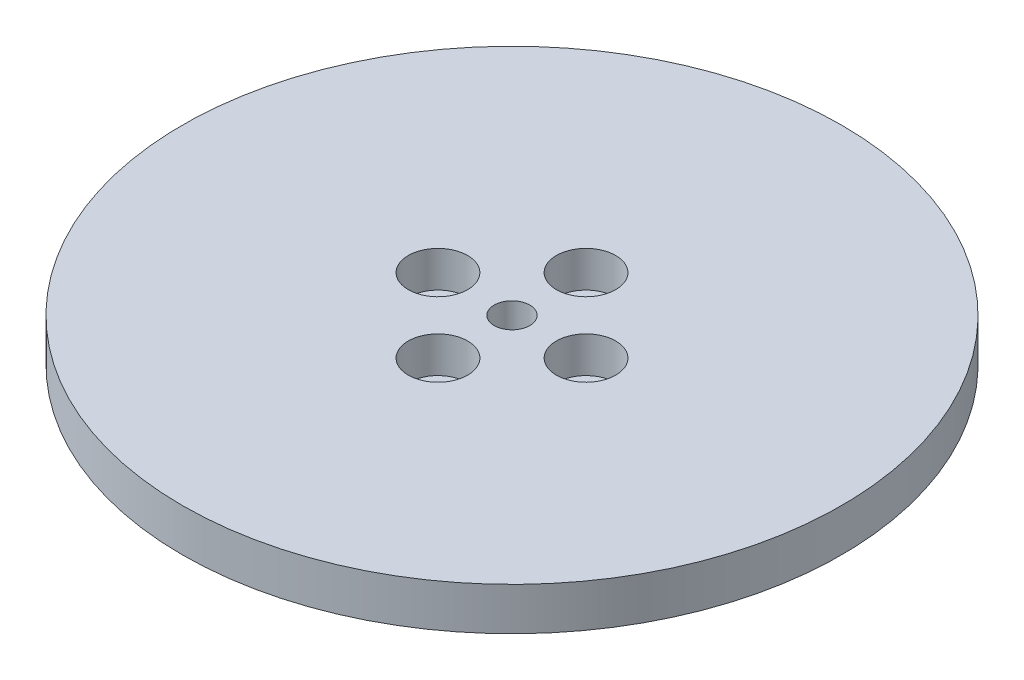
from build123d import *

# Parameters (mm, degrees)
SKETCH1_R           = 92.5
BOSS_EXTRUDE1_DEPTH = 12
SKETCH2_R           = 5
CUT_EXTRUDE1_DEPTH  = 132.363998112
SKETCH3_R           = 8.324476483
CUT_EXTRUDE2_DEPTH  = 10.146146935
CIRPATTERN1_COUNT   = 4


with BuildPart() as part:
    # Sketch1 → Boss-Extrude1 (new body)
    with BuildSketch(Plane(origin=(0, 0, 0), x_dir=(1, 0, 0), z_dir=(0, 1, 0))):
        Circle(SKETCH1_R)
    extrude(amount=BOSS_EXTRUDE1_DEPTH)

    # Sketch2 → Cut-Extrude1 (cut, through all)
    with BuildSketch(Plane(origin=(0, 0, 0), x_dir=(1, 0, 0), z_dir=(0, 1, 0))):
        Circle(SKETCH2_R)
    extrude(amount=CUT_EXTRUDE1_DEPTH, mode=Mode.SUBTRACT)

    # Sketch3 → Cut-Extrude2 (cut)
    with BuildSketch(Plane(origin=(0, 12, 0), x_dir=(1, 0, 0), z_dir=(0, 1, 0))):
        with Locations((-20.780099907, 0)):
            Circle(SKETCH3_R)
    cut_extrude2 = extrude(amount=-CUT_EXTRUDE2_DEPTH, mode=Mode.SUBTRACT)

    # CirPattern1: Cut-Extrude2 ×4 about axis
    cirpattern1_axis = Axis((0, 0, 0), (0, 1, 0))
    for i in range(1, CIRPATTERN1_COUNT):
        add(cut_extrude2.rotate(cirpattern1_axis, i * 360 / CIRPATTERN1_COUNT), mode=Mode.SUBTRACT)


solid = part.part
